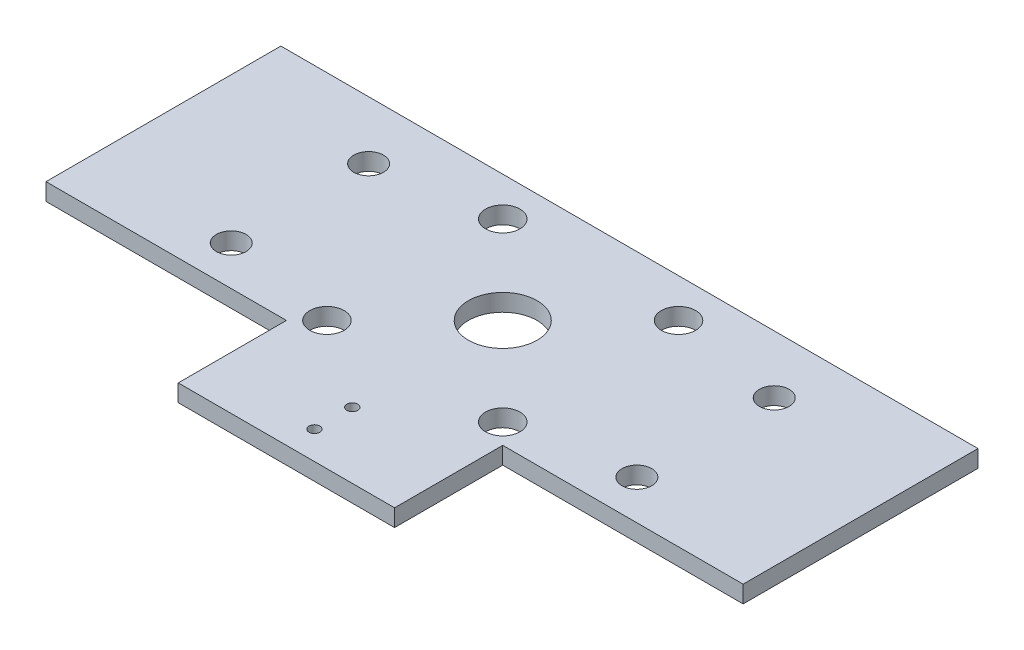
from build123d import *

# Parameters (mm, degrees)
PLATEOUTLINE_W        = 80
PLATEOUTLINE_H        = 40
BOSS_EXTRUDE1_DEPTH   = 6.35
RAILGUIDES_R          = 6.35
CUT_EXTRUDE1_DEPTH    = 10
FUELGRAINMOUNTING_R   = 12.7
CUT_EXTRUDE2_DEPTH    = 10
SKETCH2_R             = 2
CUT_EXTRUDE3_DEPTH    = 10
M10_CLEARANCE_HOLE1_D = 11


with BuildPart() as part:
    # plateOutline → Boss-Extrude1 (new body)
    with BuildSketch(Plane(origin=(0, 0, 0), x_dir=(1, 0, 0), z_dir=(0, 1, 0))):
        Polygon((-128.9, -40), (-40, -40), (40, -40), (128.9, -40), (128.9, 40), (128.9, 46.849926081), (-128.9, 46.849926081), (-128.9, 40), align=None)
        Polygon((-128.9, -40), (-40, -40), (40, -40), (128.9, -40), (128.9, 40), (128.9, 46.849926081), (-128.9, 46.849926081), (-128.9, 40), align=None)
        with Locations((0, -60)):
            Rectangle(PLATEOUTLINE_W, PLATEOUTLINE_H)
    extrude(amount=BOSS_EXTRUDE1_DEPTH)

    # railGuides → Cut-Extrude1 (cut)
    with BuildSketch(Plane(origin=(0, 0, 0), x_dir=(1, 0, 0), z_dir=(0, 1, 0))):
        with Locations((-32.5, 32.5)):
            Circle(RAILGUIDES_R)
        with Locations((32.5, 32.5)):
            Circle(RAILGUIDES_R)
        with Locations((32.5, -32.5)):
            Circle(RAILGUIDES_R)
        with Locations((-32.5, -32.5)):
            Circle(RAILGUIDES_R)
    extrude(amount=CUT_EXTRUDE1_DEPTH, mode=Mode.SUBTRACT)

    # FuelGrainMounting → Cut-Extrude2 (cut)
    with BuildSketch(Plane(origin=(0, 0, 0), x_dir=(1, 0, 0), z_dir=(0, 1, 0))):
        Circle(FUELGRAINMOUNTING_R)
    extrude(amount=CUT_EXTRUDE2_DEPTH, mode=Mode.SUBTRACT)

    # Sketch2 → Cut-Extrude3 (cut)
    with BuildSketch(Plane(origin=(0, 0, 0), x_dir=(1, 0, 0), z_dir=(0, 1, 0))):
        with Locations((0, -69.63)):
            Circle(SKETCH2_R)
        with Locations((0, -55.63)):
            Circle(SKETCH2_R)
    extrude(amount=CUT_EXTRUDE3_DEPTH, mode=Mode.SUBTRACT)

    # M10 Clearance Hole1 (through all)
    with Locations(Plane(origin=(0, 6.35, 0), x_dir=(1, 0, 0), z_dir=(0, 1, 0))):
        with Locations((75, -25.4), (-75, 25.4), (-75, -25.4), (75, 25.4)):
            Hole(M10_CLEARANCE_HOLE1_D / 2)


solid = part.part
